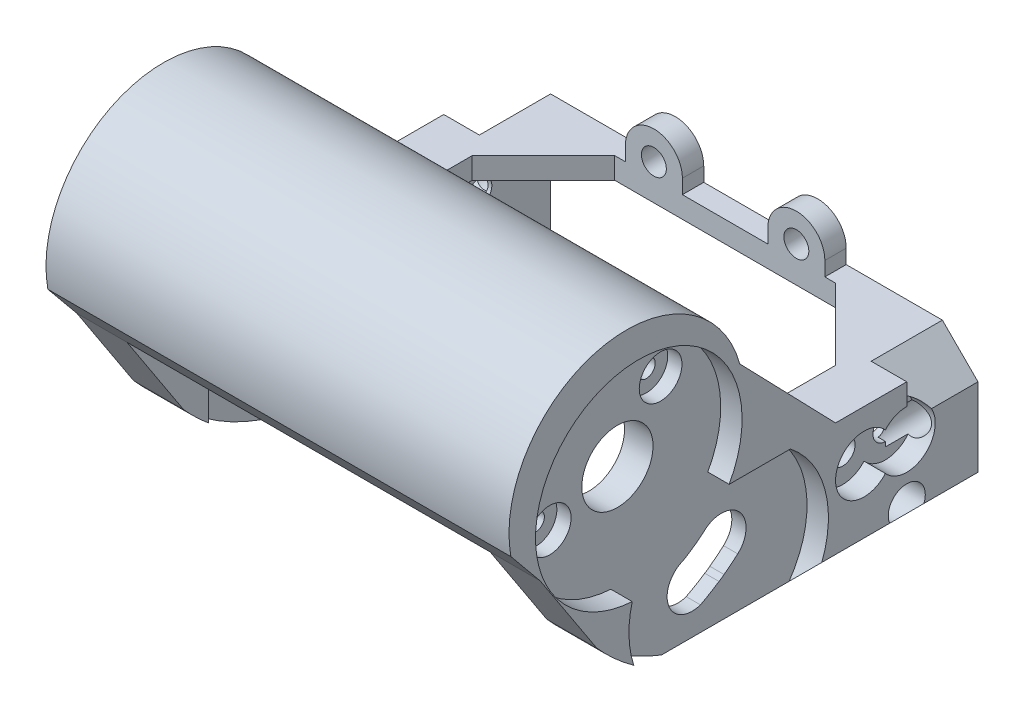
from build123d import *

# Parameters (mm, degrees)
BOSS_EXTRUDE1_DEPTH             = 50
CHAMFER1_SIZE                   = 7
SKETCH2_R                       = 3.5
CUT_EXTRUDE1_DEPTH              = 62.524385409
SKETCH3_R                       = 1.75
CUT_EXTRUDE2_DEPTH              = 62.524385409
SKETCH5_R                       = 14
CUT_EXTRUDE4_DEPTH              = 3
BOSS_EXTRUDE2_DEPTH             = 7
CUT_EXTRUDE3_DEPTH              = 77.547867994
CUT_EXTRUDE3_DEPTH_BACK         = 77.547867994
SKETCH4_W                       = 51
SKETCH4_H                       = 47
SKETCH7_R                       = 1.25
SKETCH7_R_2                     = 5
CUT_EXTRUDE5_DEPTH              = 103.505990745
SKETCH8_R                       = 14.5
CUT_EXTRUDE6_DEPTH              = 3
SKETCH9_R                       = 3
CUT_EXTRUDE7_DEPTH              = 2
SKETCH11_R                      = 2
CUT_EXTRUDE8_DEPTH              = 10
BOSS_EXTRUDE3_START             = -32.5
BOSS_EXTRUDE3_DEPTH             = 65
SKETCH12_R                      = 2.6
CUT_EXTRUDE9_DEPTH              = 105.684053225
CUT_EXTRUDE10_DEPTH             = 3
BOSS_EXTRUDE4_DEPTH             = 3
SKETCH16_R                      = 1.75
CUT_EXTRUDE12_DEPTH             = 8
CHAMFER2_SIZE                   = 10
CUT_EXTRUDE14_DEPTH             = 10
CUT_EXTRUDE15_DEPTH             = 89.260982281
CUT_EXTRUDE15_DEPTH_BACK        = 89.260982281
CUT_EXTRUDE16_REACH             = 90.261
SKETCH19_R                      = 11
CUT_EXTRUDE16_DIRECTION_2_REACH = 90.261
CUT_EXTRUDE17_DEPTH             = 103.848193952


# Read off the part's stored shape, not the designer's step: Mirror1
with BuildPart() as part:
    # Sketch1 → Boss-Extrude1 (new body)
    with BuildSketch(Plane.XY):
        Polygon((-27.5, 0), (-27.5, 20), (0, 20), (0, 23), (-32.5, 23), (-32.5, 0), align=None)
    extrude(amount=BOSS_EXTRUDE1_DEPTH)

    # Chamfer1
    # the kernel refuses this chamfer: 7 mm, written as the material it takes off along each edge
    with BuildSketch(Plane(origin=(-32.5, 0, -18.001780916), x_dir=(-0.02749587661058612, 0.9996219169112968, 0), z_dir=(0, 0, 1))) as chamfer1_piece_1:
        Polygon((CHAMFER1_SIZE * 0.999621916911, -CHAMFER1_SIZE * 0.0274958766106), (-CHAMFER1_SIZE * 0.0274958766106, -CHAMFER1_SIZE * 0.999621916911), (0, 0), align=None)
    extrude(amount=86.003561832, mode=Mode.SUBTRACT)

    # Sketch2 → Cut-Extrude1 (cut, through all)
    with BuildSketch(Plane(origin=(-27.5, 0, 0), x_dir=(0, 0, -1), z_dir=(1, 0, 0))):
        with Locations((-35, 12)):
            Circle(SKETCH2_R)
    extrude(amount=-CUT_EXTRUDE1_DEPTH, mode=Mode.SUBTRACT)

    # Sketch3 → Cut-Extrude2 (cut, through all)
    with BuildSketch(Plane(origin=(-27.5, 0, 0), x_dir=(0, 0, -1), z_dir=(1, 0, 0))):
        with Locations((-10, 16)):
            Circle(SKETCH3_R)
        with Locations((-16, 16)):
            Circle(SKETCH3_R)
    extrude(amount=-CUT_EXTRUDE2_DEPTH, mode=Mode.SUBTRACT)

    # Sketch5 → Cut-Extrude4 (cut)
    with BuildSketch(Plane.ZY.offset(32.5)):
        with Locations((35, 12)):
            Circle(SKETCH5_R)
    extrude(amount=-CUT_EXTRUDE4_DEPTH, mode=Mode.SUBTRACT)

    # Sketch6 → Boss-Extrude2 (add)
    with BuildSketch(Plane.ZY.offset(32.5)):
        with BuildLine():
            Line((38.91656851, 42.559195759), (20, 23))
            Line((20, 23), (41.190648452, 23))
            ThreePointArc((41.190648452, 23), (45.305332833, 20.647646722), (50, 19.996268429))
            Line((50, 19.996268429), (50, 7))
            Line((50, 7), (61.474012963, 24.541456905))
            ThreePointArc((61.474012963, 24.541456905), (58.38884507, 43.808308659), (38.91656851, 42.559195759))
        make_face()
    extrude(amount=-BOSS_EXTRUDE2_DEPTH)

    # Mirror1: part across plane


with BuildPart() as part_1:
    add(part.part)
    add(part.part.mirror(Plane(origin=(0, 0, 0), x_dir=(0, 0, 1), z_dir=(1, 0, 0))))

    # Sketch4 → Cut-Extrude3 (cut, two sides: drawn at the far end of the back side and taken through both)
    with BuildSketch(Plane.XZ.offset(-20).offset(-CUT_EXTRUDE3_DEPTH_BACK)):
        with Locations((0, 26.5)):
            Rectangle(SKETCH4_W, SKETCH4_H)
    extrude(amount=CUT_EXTRUDE3_DEPTH + CUT_EXTRUDE3_DEPTH_BACK, mode=Mode.SUBTRACT)

    # Sketch7 → Cut-Extrude5 (cut, through all)
    with BuildSketch(Plane.ZY.offset(32.5)):
        with Locations(Location((41.557466488, 37.927777253, 0), (0, 0, 270))):
            Circle(SKETCH7_R)
        with Locations(Location((57.12135533, 27.029824962, 0), (0, 0, 270))):
            Circle(SKETCH7_R)
        with Locations(Location((47.6186816, 30.021344974, 0), (0, 0, 270))):
            Circle(SKETCH7_R_2)
    extrude(amount=-CUT_EXTRUDE5_DEPTH, mode=Mode.SUBTRACT)

    # Sketch8 → Cut-Extrude6 (cut)
    with BuildSketch(Plane.ZY.offset(32.5)):
        with Locations((47.6186816, 30.021344974)):
            Circle(SKETCH8_R)
    cut_extrude6 = extrude(amount=-CUT_EXTRUDE6_DEPTH, mode=Mode.SUBTRACT)

    # Sketch9 → Cut-Extrude7 (cut)
    with BuildSketch(Plane.ZY.offset(29.5)):
        with Locations(Location((41.557466488, 37.927777253, 0), (0, 0, 270))):
            Circle(SKETCH9_R)
        with Locations(Location((57.12135533, 27.029824962, 0), (0, 0, 270))):
            Circle(SKETCH9_R)
    cut_extrude7 = extrude(amount=-CUT_EXTRUDE7_DEPTH, mode=Mode.SUBTRACT)

    # Sketch11 → Cut-Extrude8 (cut)
    with BuildSketch(Plane(origin=(0, 0, 0), x_dir=(-1, 0, 0), z_dir=(0, 0, -1))):
        with Locations((-30, 15.523029521)):
            Circle(SKETCH11_R)
    cut_extrude8 = extrude(amount=-CUT_EXTRUDE8_DEPTH, mode=Mode.SUBTRACT)

    # Mirror2: Cut-Extrude6, Cut-Extrude7, Cut-Extrude8 across plane
    add(cut_extrude6.mirror(Plane(origin=(0, 0, 0), x_dir=(0, 0, 1), z_dir=(1, 0, 0))), mode=Mode.SUBTRACT)
    add(cut_extrude7.mirror(Plane(origin=(0, 0, 0), x_dir=(0, 0, 1), z_dir=(1, 0, 0))), mode=Mode.SUBTRACT)
    add(cut_extrude8.mirror(Plane(origin=(0, 0, 0), x_dir=(0, 0, 1), z_dir=(1, 0, 0))), mode=Mode.SUBTRACT)

    # Sketch10 → Boss-Extrude3 (add)
    with BuildSketch(Plane(origin=(0, 0, 0), x_dir=(0, 0, -1), z_dir=(1, 0, 0)).offset(BOSS_EXTRUDE3_START)):
        with BuildLine():
            Line((-38.91656851, 42.559195759), (-33.44256114, 36.899227268))
            ThreePointArc((-33.44256114, 36.899227268), (-53.026270805, 48.561620018), (-65.574367209, 29.533263138))
            Line((-65.574367209, 29.533263138), (-61.474012963, 24.541456905))
            ThreePointArc((-61.474012963, 24.541456905), (-58.38884507, 43.808308659), (-38.91656851, 42.559195759))
        make_face()
    extrude(amount=BOSS_EXTRUDE3_DEPTH)

    # Sketch12 → Cut-Extrude9 (cut, through all)
    with BuildSketch(Plane(origin=(32.5, 0, 0), x_dir=(0, 0, -1), z_dir=(1, 0, 0))):
        with Locations(Location((-10, 8, 0), (0, 0, 180))):
            Circle(SKETCH12_R)
    extrude(amount=-CUT_EXTRUDE9_DEPTH, mode=Mode.SUBTRACT)

    # Sketch13 → Cut-Extrude10 (cut)
    with BuildSketch(Plane(origin=(32.5, 0, 0), x_dir=(0, 0, -1), z_dir=(1, 0, 0))):
        with BuildLine():
            ThreePointArc((-13, 18.645751311), (-20, 16), (-13, 13.354248689))
            ThreePointArc((-13, 13.354248689), (-6, 16), (-13, 18.645751311))
        make_face()
    cut_extrude10 = extrude(amount=-CUT_EXTRUDE10_DEPTH, mode=Mode.SUBTRACT)

    # Mirror3: Cut-Extrude10 across plane
    add(cut_extrude10.mirror(Plane(origin=(0, 0, 0), x_dir=(0, 0, 1), z_dir=(1, 0, 0))), mode=Mode.SUBTRACT)

    # Sketch15 → Boss-Extrude4 (add)
    with BuildSketch(Plane(origin=(0, 0, 0), x_dir=(-1, 0, 0), z_dir=(0, 0, -1))):
        with BuildLine():
            Line((-14, 25), (-14, 23))
            Line((-14, 23), (-6, 23))
            Line((-6, 23), (-6, 25))
            ThreePointArc((-6, 25), (-10, 29), (-14, 25))
        make_face()
        with BuildLine():
            Line((6, 23), (6, 25))
            ThreePointArc((6, 25), (10, 29), (14, 25))
            Line((14, 25), (14, 23))
            Line((14, 23), (6, 23))
        make_face()
    extrude(amount=-BOSS_EXTRUDE4_DEPTH)

    # Sketch16 → Cut-Extrude12 (cut)
    with BuildSketch(Plane(origin=(0, 0, 0), x_dir=(-1, 0, 0), z_dir=(0, 0, -1))):
        with Locations((-10, 25)):
            Circle(SKETCH16_R)
        with Locations((10, 25)):
            Circle(SKETCH16_R)
    extrude(amount=-CUT_EXTRUDE12_DEPTH, mode=Mode.SUBTRACT)

    # Chamfer2
    chamfer2_edges = [part_1.edges().sort_by_distance(p)[0] for p in [
        (25.5, 21.5, 3),
        (-25.5, 21.5, 3),
    ]]
    chamfer(chamfer2_edges, length=CHAMFER2_SIZE)

    # Sketch17 → Cut-Extrude14 (cut)
    with BuildSketch(Plane(origin=(0, 0, 0), x_dir=(-1, 0, 0), z_dir=(0, 0, -1))):
        Polygon((-32.5, 18), (-32.5, 23), (-27.5, 23), align=None)
        Polygon((32.5, 23), (27.5, 23), (32.5, 18), align=None)
    extrude(amount=-CUT_EXTRUDE14_DEPTH, mode=Mode.SUBTRACT)

    # Sketch18 → Cut-Extrude15 (cut, two sides: drawn at the far end of the back side and taken through both)
    with BuildSketch(Plane(origin=(0, 0, 0), x_dir=(0, 0, -1), z_dir=(1, 0, 0)).offset(-CUT_EXTRUDE15_DEPTH_BACK)):
        with BuildLine():
            Line((-30.530550933, 2), (-50, 2))
            Line((-50, 2), (-58.261274719, 19.629826629))
            ThreePointArc((-58.261274719, 19.629826629), (-46.960735265, 6.780592155), (-30.530550933, 2))
        make_face()
    extrude(amount=CUT_EXTRUDE15_DEPTH + CUT_EXTRUDE15_DEPTH_BACK, mode=Mode.SUBTRACT)

    # Cut-Extrude16: up to this face of the body (flat: up to its plane)
    cut_extrude16_end = Plane(part_1.part.faces().sort_by_distance((-27.5, 11.293188811, 24.090581316))[0])
    # Sketch19 → Cut-Extrude16 (cut, up to the picked face)
    with BuildSketch(Plane(origin=(0, 0, 0), x_dir=(0, 0, -1), z_dir=(1, 0, 0)), mode=Mode.PRIVATE) as cut_extrude16_sk1:
        with Locations((-35, 12)):
            Circle(SKETCH19_R)
    cut_extrude16_tool1 = split(extrude(cut_extrude16_sk1.sketch, amount=-CUT_EXTRUDE16_REACH, mode=Mode.PRIVATE), bisect_by=cut_extrude16_end, keep=Keep.BOTH, mode=Mode.PRIVATE)
    add(cut_extrude16_tool1.solids().sort_by(Axis((0, 12, 35), (-1, 0, 0)))[0], mode=Mode.SUBTRACT)

    # Cut-Extrude16 direction 2: up to this face of the body (flat: up to its plane)
    cut_extrude16_direction_2_end = Plane(part_1.part.faces().sort_by_distance((27.5, 11.293188811, 24.090581316))[0])
    # Sketch19 → Cut-Extrude16 direction 2 (cut, up to the picked face)
    with BuildSketch(Plane(origin=(0, 0, 0), x_dir=(0, 0, -1), z_dir=(1, 0, 0)), mode=Mode.PRIVATE) as cut_extrude16_direction_2_sk1:
        with Locations((-35, 12)):
            Circle(SKETCH19_R)
    cut_extrude16_direction_2_tool1 = split(extrude(cut_extrude16_direction_2_sk1.sketch, amount=CUT_EXTRUDE16_DIRECTION_2_REACH, mode=Mode.PRIVATE), bisect_by=cut_extrude16_direction_2_end, keep=Keep.BOTH, mode=Mode.PRIVATE)
    add(cut_extrude16_direction_2_tool1.solids().sort_by(Axis((0, 12, 35), (1, 0, 0)))[0], mode=Mode.SUBTRACT)

    # Sketch20 → Cut-Extrude17 (cut, through all)
    with BuildSketch(Plane.ZY.offset(29.5)):
        with BuildLine():
            ThreePointArc((35.338857782, 16.153716102), (30.430818443, 15.855675228), (30.728859318, 10.947635889))
            ThreePointArc((30.728859318, 10.947635889), (33.235107626, 8.993143085), (35.965203237, 7.365905958))
            ThreePointArc((35.965203237, 7.365905958), (40.432511893, 9.479255027), (38.372112666, 13.971230754))
            ThreePointArc((38.372112666, 13.971230754), (36.800308025, 14.985787228), (35.338857782, 16.153716102))
        make_face()
    extrude(amount=-CUT_EXTRUDE17_DEPTH, mode=Mode.SUBTRACT)


solid = part_1.part
